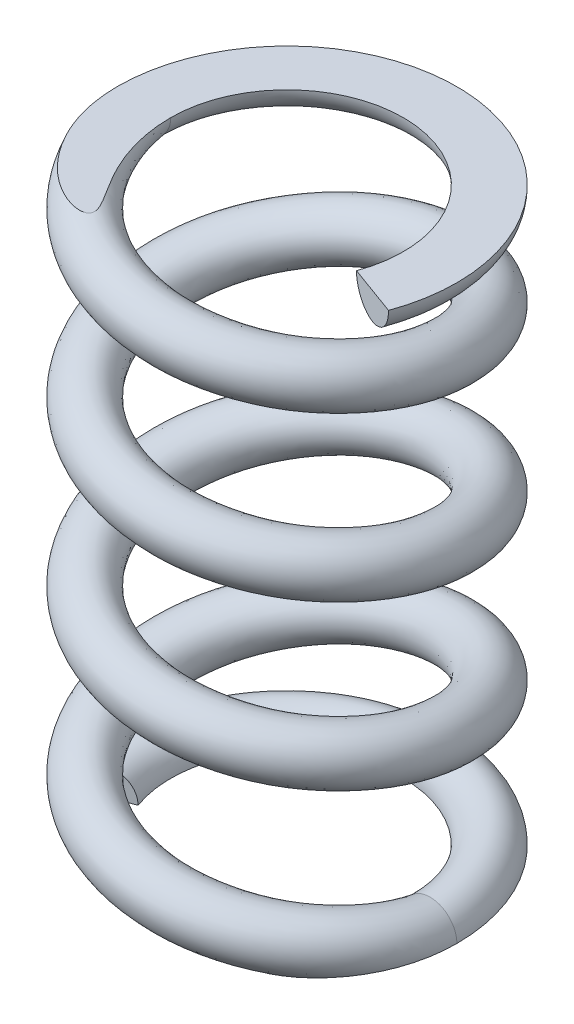
from build123d import *

# Parameters (mm, degrees)
SWEEP1_PITCH       = 2.285714286
SWEEP1_HEIGHT      = 8
SWEEP1_RADIUS      = 2
SWEEP1_START_ANGLE = 90
SKETCH1_R          = 0.375
SKETCH1_3_R        = 0.375
REVOLVE1_ANGLE     = 200
SKETCH4_R          = 2.5
CUT_EXTRUDE1_DEPTH = 10.023409681
SKETCH6_R          = 0.375
REVOLVE2_ANGLE     = 200
SKETCH7_R          = 2.5
CUT_EXTRUDE2_DEPTH = 10.023409681


with BuildPart() as part:
    # Sweep1: sweep along a helix
    with BuildLine() as sweep1_path:
        add(Helix(SWEEP1_PITCH, SWEEP1_HEIGHT, SWEEP1_RADIUS, center=(0, 0, 0), direction=(0, 1, 0), lefthand=True, mode=Mode.PRIVATE).rotate(Axis((0, 0, 0), (0, 1, 0)), SWEEP1_START_ANGLE))
    # Sketch1 → Sweep1 (sweep)
    with BuildSketch(Plane.XY):
        with Locations((2, 0)):
            Circle(SKETCH1_R)
    sweep(path=sweep1_path.line, is_frenet=True)

    # Sketch1<3> → Revolve1 (revolve)
    with BuildSketch(Plane.XY):
        with Locations((2, 0)):
            Circle(SKETCH1_3_R)
    revolve(axis=Axis((0, 0, 0), (0, 1, 0)), revolution_arc=REVOLVE1_ANGLE)

    # Sketch4 → Cut-Extrude1 (cut, through all)
    with BuildSketch(Plane(origin=(0, 0, 0), x_dir=(1, 0, 0), z_dir=(0, 1, 0))):
        Circle(SKETCH4_R)
    extrude(amount=-CUT_EXTRUDE1_DEPTH, mode=Mode.SUBTRACT)

    # Sketch6 → Revolve2 (revolve)
    with BuildSketch(Plane(origin=(0, 0, 0), x_dir=(-1, 0, 0), z_dir=(0, 0, -1))):
        with Locations((2, 8)):
            Circle(SKETCH6_R)
    revolve(axis=Axis((0, 0, 0), (0, -1, 0)), revolution_arc=REVOLVE2_ANGLE)

    # Sketch7 → Cut-Extrude2 (cut, through all)
    with BuildSketch(Plane(origin=(0, 8, 0), x_dir=(1, 0, 0), z_dir=(0, 1, 0))):
        Circle(SKETCH7_R)
    extrude(amount=CUT_EXTRUDE2_DEPTH, mode=Mode.SUBTRACT)


solid = part.part
